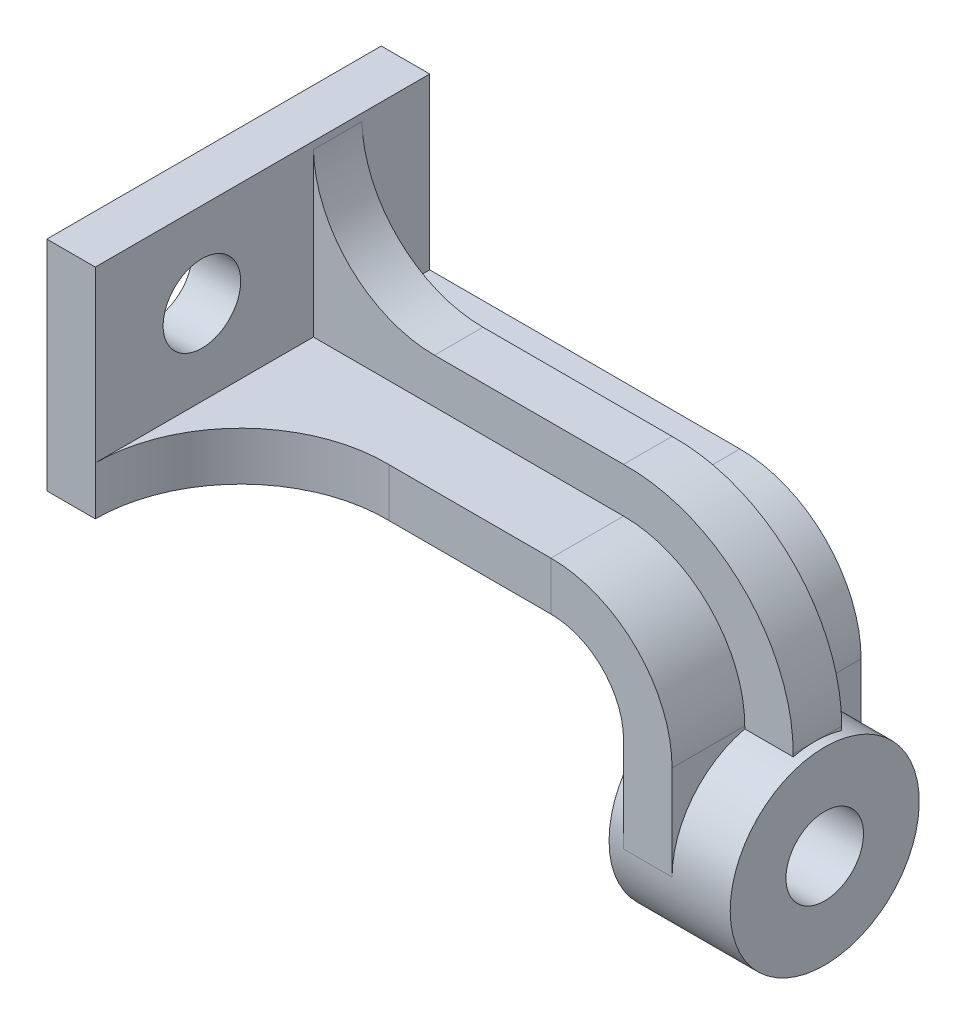
from build123d import *

# Parameters (mm, degrees)
SKETCH1_W           = 69
SKETCH1_H           = 45
BOSS_EXTRUDE1_DEPTH = 10
BOSS_EXTRUDE2_DEPTH = 69
CUT_EXTRUDE1_DEPTH  = 69
CUT_EXTRUDE2_DEPTH  = 30
SKETCH6_R           = 19.5
BOSS_EXTRUDE3_DEPTH = 12
CUT_EXTRUDE3_START  = -12
CUT_EXTRUDE3_DEPTH  = 12
BOSS_EXTRUDE4_START = 3
SKETCH8_R           = 19.5
BOSS_EXTRUDE4_DEPTH = 3
CUT_EXTRUDE4_REACH  = 124.458
SKETCH9_R           = 8
BOSS_EXTRUDE5_DEPTH = 5
CUT_EXTRUDE5_REACH  = 132.828
SKETCH14_R          = 8


with BuildPart() as part:
    # Sketch1 → Boss-Extrude1 (new body)
    with BuildSketch(Plane(origin=(0, 0, 0), x_dir=(0, 0, -1), z_dir=(1, 0, 0))):
        with Locations((8.845653905, 22.5)):
            Rectangle(SKETCH1_W, SKETCH1_H)
    extrude(amount=-BOSS_EXTRUDE1_DEPTH)

    # Sketch2 → Boss-Extrude2 (add)
    with BuildSketch(Plane.XY.offset(25.654346095)):
        with BuildLine():
            Line((64, 10), (0, 10))
            Line((0, 10), (0, 0))
            Line((0, 0), (44.854374374, 0))
            Line((44.854374374, 0), (64, 0))
            ThreePointArc((64, 0), (74.606601718, -4.393398282), (79, -15))
            Line((79, -15), (79, -55.367791419))
            Line((79, -55.367791419), (89, -55.367791419))
            Line((89, -55.367791419), (89, -15))
            ThreePointArc((89, -15), (81.67766953, 2.67766953), (64, 10))
        make_face()
    extrude(amount=-BOSS_EXTRUDE2_DEPTH)

    # Sketch4 → Cut-Extrude1 (cut)
    with BuildSketch(Plane(origin=(0, 10, 0), x_dir=(1, 0, 0), z_dir=(0, 1, 0))):
        with BuildLine():
            ThreePointArc((30.643579789, 4.338749862), (9.015569982, -4.21481026), (0, -25.654346095))
            Line((0, -25.654346095), (64, -25.654346095))
            Line((64, -25.654346095), (64, 4.338749862))
            Line((64, 4.338749862), (30.643579789, 4.338749862))
        make_face()
    extrude(amount=-CUT_EXTRUDE1_DEPTH, mode=Mode.SUBTRACT)

    # Sketch5 → Cut-Extrude2 (cut)
    with BuildSketch(Plane.XY.offset(25.654346095)):
        with BuildLine():
            Line((79, -15), (79, -55.367791419))
            Line((79, -55.367791419), (89, -55.367791419))
            Line((89, -55.367791419), (89, -15))
            ThreePointArc((89, -15), (81.67766953, 2.67766953), (64, 10))
            Line((64, 10), (64, 0))
            ThreePointArc((64, 0), (74.606601718, -4.393398282), (79, -15))
        make_face()
    extrude(amount=-CUT_EXTRUDE2_DEPTH, mode=Mode.SUBTRACT)

    # Sketch6 → Boss-Extrude3 (add)
    with BuildSketch(Plane(origin=(89, 0, 0), x_dir=(0, 0, -1), z_dir=(1, 0, 0))):
        with Locations((23.845653905, -34.5)):
            Circle(SKETCH6_R)
    extrude(amount=BOSS_EXTRUDE3_DEPTH)

    # Sketch7 → Cut-Extrude3 (cut)
    with BuildSketch(Plane(origin=(89, 0, 0), x_dir=(0, 0, -1), z_dir=(1, 0, 0)).offset(CUT_EXTRUDE3_START)):
        with BuildLine():
            Line((4.345653905, -34.5), (4.345653905, -55.367791419))
            Line((4.345653905, -55.367791419), (43.345653905, -55.367791419))
            Line((43.345653905, -55.367791419), (43.345653905, -34.5))
            ThreePointArc((43.345653905, -34.5), (23.845653905, -54), (4.345653905, -34.5))
        make_face()
    extrude(amount=CUT_EXTRUDE3_DEPTH, mode=Mode.SUBTRACT)

    # Sketch8 → Boss-Extrude4 (add)
    with BuildSketch(Plane.ZY.offset(-79).offset(BOSS_EXTRUDE4_START)):
        with Locations((-23.845653905, -34.5)):
            Circle(SKETCH8_R)
    extrude(amount=-BOSS_EXTRUDE4_DEPTH)

    # Sketch9 → Cut-Extrude4 (cut, up to next)
    with BuildSketch(Plane(origin=(0, 0, 0), x_dir=(0, 0, -1), z_dir=(1, 0, 0)), mode=Mode.PRIVATE) as cut_extrude4_sk1:
        with Locations((-3.654346095, 27.5)):
            Circle(SKETCH9_R)
    cut_extrude4_tool1 = extrude(cut_extrude4_sk1.sketch, amount=-CUT_EXTRUDE4_REACH, mode=Mode.PRIVATE) & part.part
    add(cut_extrude4_tool1.solids().sort_by_distance((0, 27.5, 3.654346))[0], mode=Mode.SUBTRACT)

    # Sketch13 → Boss-Extrude5 (add, symmetric)
    with BuildSketch(Plane(origin=(0, 0, -24.345653905), x_dir=(-1, 0, 0), z_dir=(0, 0, -1))):
        with BuildLine():
            Line((0, 10), (0, 43.487506986))
            ThreePointArc((0, 43.487506986), (-7.58031637, 26.300702433), (-24.988559207, 19.243753493))
            Line((-24.988559207, 19.243753493), (-64, 19.243753493))
            ThreePointArc((-64, 19.243753493), (-88.701898796, 9.482823843), (-99, -15))
            Line((-99, -15), (-99, -34.5))
            Line((-99, -34.5), (-89, -34.5))
            Line((-89, -34.5), (-89, -15))
            ThreePointArc((-89, -15), (-81.67766953, 2.67766953), (-64, 10))
            Line((-64, 10), (0, 10))
        make_face()
    extrude(amount=BOSS_EXTRUDE5_DEPTH, both=True)

    # Sketch14 → Cut-Extrude5 (cut, up to next)
    with BuildSketch(Plane(origin=(101, 0, 0), x_dir=(0, 0, -1), z_dir=(1, 0, 0)), mode=Mode.PRIVATE) as cut_extrude5_sk1:
        with Locations((23.845653905, -34.5)):
            Circle(SKETCH14_R)
    cut_extrude5_tool1 = extrude(cut_extrude5_sk1.sketch, amount=-CUT_EXTRUDE5_REACH, mode=Mode.PRIVATE) & part.part
    add(cut_extrude5_tool1.solids().sort_by_distance((101, -34.5, -23.845654))[0], mode=Mode.SUBTRACT)


solid = part.part
